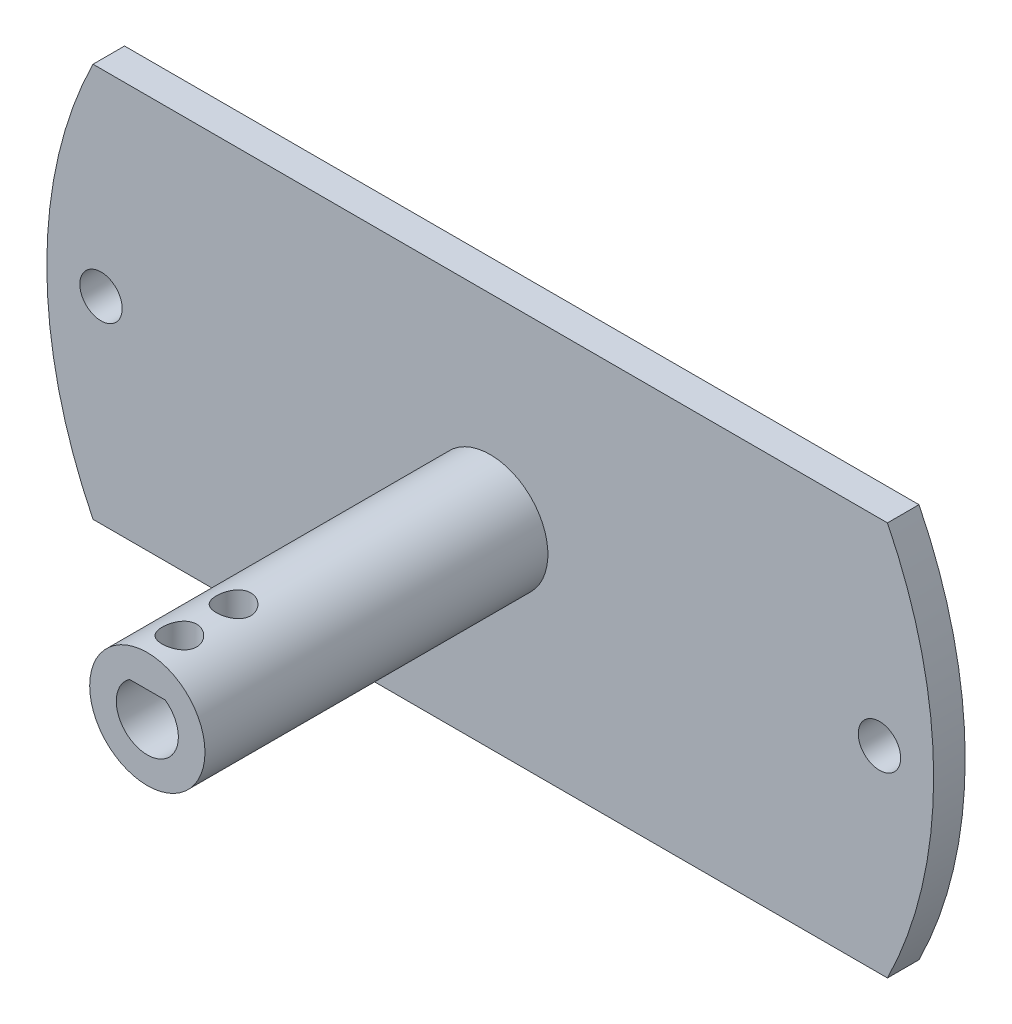
from build123d import *

# Parameters (mm, degrees)
CROQUIS1_R                 = 5.85
SALIENTE_EXTRUIR1_DEPTH    = 38
CROQUIS2_R                 = 1.75
CORTAR_EXTRUIR1_DEPTH      = 7.5
CROQUIS3_R                 = 45
SALIENTE_EXTRUIR2_DEPTH    = 3.2
CORTAR_EXTRUIR2_DEPTH      = 75.121521892
CORTAR_EXTRUIR2_DEPTH_BACK = 5
CROQUIS5_R                 = 2.15


with BuildPart() as part:
    # Croquis1 → Saliente-Extruir1 (new body)
    with BuildSketch(Plane.XY):
        Circle(CROQUIS1_R)
        with BuildLine():
            Line((-1.8, 2.585053191), (1.8, 2.585053191))
            ThreePointArc((1.8, 2.585053191), (0, -3.15), (-1.8, 2.585053191))
        make_face(mode=Mode.SUBTRACT)
    extrude(amount=SALIENTE_EXTRUIR1_DEPTH)

    # Croquis2 → Cortar-Extruir1 (cut)
    with BuildSketch(Plane(origin=(0, 2.585053191, 0), x_dir=(1, 0, 0), z_dir=(0, 1, 0))):
        with Locations((0, -34.75)):
            Circle(CROQUIS2_R)
        with Locations((0, -29.25)):
            Circle(CROQUIS2_R)
    extrude(amount=CORTAR_EXTRUIR1_DEPTH, mode=Mode.SUBTRACT)

    # Croquis3 → Saliente-Extruir2 (add)
    with BuildSketch(Plane(origin=(0, 0, 0), x_dir=(-1, 0, 0), z_dir=(0, 0, -1))):
        Circle(CROQUIS3_R)
    extrude(amount=-SALIENTE_EXTRUIR2_DEPTH)

    # Croquis5 → Cortar-Extruir2 (cut, two sides: drawn at the far end of the back side and taken through both)
    with BuildSketch(Plane(origin=(0, 0, 0), x_dir=(-1, 0, 0), z_dir=(0, 0, -1)).offset(-CORTAR_EXTRUIR2_DEPTH_BACK)):
        with Locations((-39.5, 0)):
            Circle(CROQUIS5_R)
        with Locations((39.5, 0)):
            Circle(CROQUIS5_R)
        Polygon((0, 20), (-75, 20), (-75, 50), (75, 50), (75, 20), align=None)
        Polygon((75, -50), (75, -20), (0, -20), (-75, -20), (-75, -50), align=None)
    extrude(amount=CORTAR_EXTRUIR2_DEPTH + CORTAR_EXTRUIR2_DEPTH_BACK, mode=Mode.SUBTRACT)


solid = part.part
